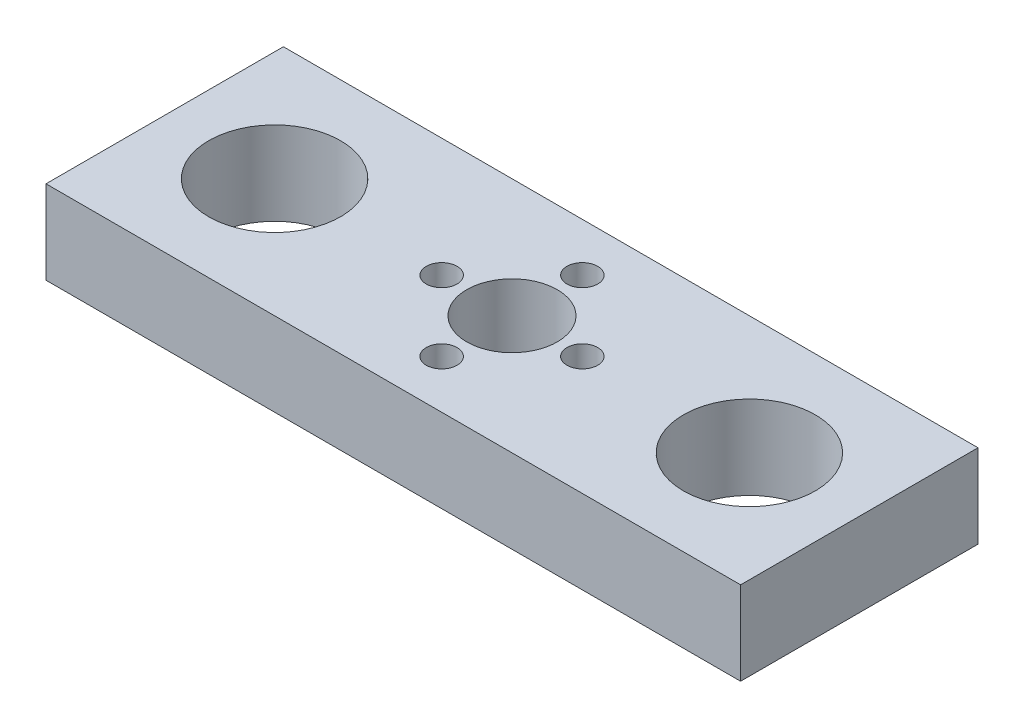
from build123d import *

# Parameters (mm, degrees)
SKETCH_1_W          = 79
SKETCH_1_H          = 27
EXTRUDE_1_DEPTH     = 9.5
SKETCH_3_R          = 7.5
CUT_EXTRUDE_1_DEPTH = 43.810629521
SKETCH_4_R          = 5.15
CUT_EXTRUDE_2_DEPTH = 43.810629521
SKETCH_5_R          = 1.75
SKETCH_5_R_2        = 1.749999993
CUT_EXTRUDE_3_DEPTH = 43.810629521


with BuildPart() as part:
    # 草图1 → 凸台-拉伸1 (new body)
    with BuildSketch(Plane(origin=(0, 0, 0), x_dir=(1, 0, 0), z_dir=(0, 1, 0))):
        Rectangle(SKETCH_1_W, SKETCH_1_H)
    extrude(amount=EXTRUDE_1_DEPTH)

    # 草图3 → 切除-拉伸1 (cut, through all)
    with BuildSketch(Plane(origin=(0, 9.5, 0), x_dir=(1, 0, 0), z_dir=(0, 1, 0))):
        with Locations((-27, 0)):
            Circle(SKETCH_3_R)
        with Locations((27, 0)):
            Circle(SKETCH_3_R)
    extrude(amount=-CUT_EXTRUDE_1_DEPTH, mode=Mode.SUBTRACT)

    # 草图4 → 切除-拉伸2 (cut, through all)
    with BuildSketch(Plane(origin=(0, 9.5, 0), x_dir=(1, 0, 0), z_dir=(0, 1, 0))):
        Circle(SKETCH_4_R)
    extrude(amount=-CUT_EXTRUDE_2_DEPTH, mode=Mode.SUBTRACT)

    # 草图5 → 切除-拉伸3 (cut, through all)
    with BuildSketch(Plane(origin=(0, 9.5, 0), x_dir=(1, 0, 0), z_dir=(0, 1, 0))):
        with Locations((8, 0)):
            Circle(SKETCH_5_R)
        with Locations((-8, 0)):
            Circle(SKETCH_5_R)
        with Locations((0, 8)):
            Circle(SKETCH_5_R_2)
        with Locations((0, -8)):
            Circle(SKETCH_5_R_2)
    extrude(amount=-CUT_EXTRUDE_3_DEPTH, mode=Mode.SUBTRACT)


solid = part.part
